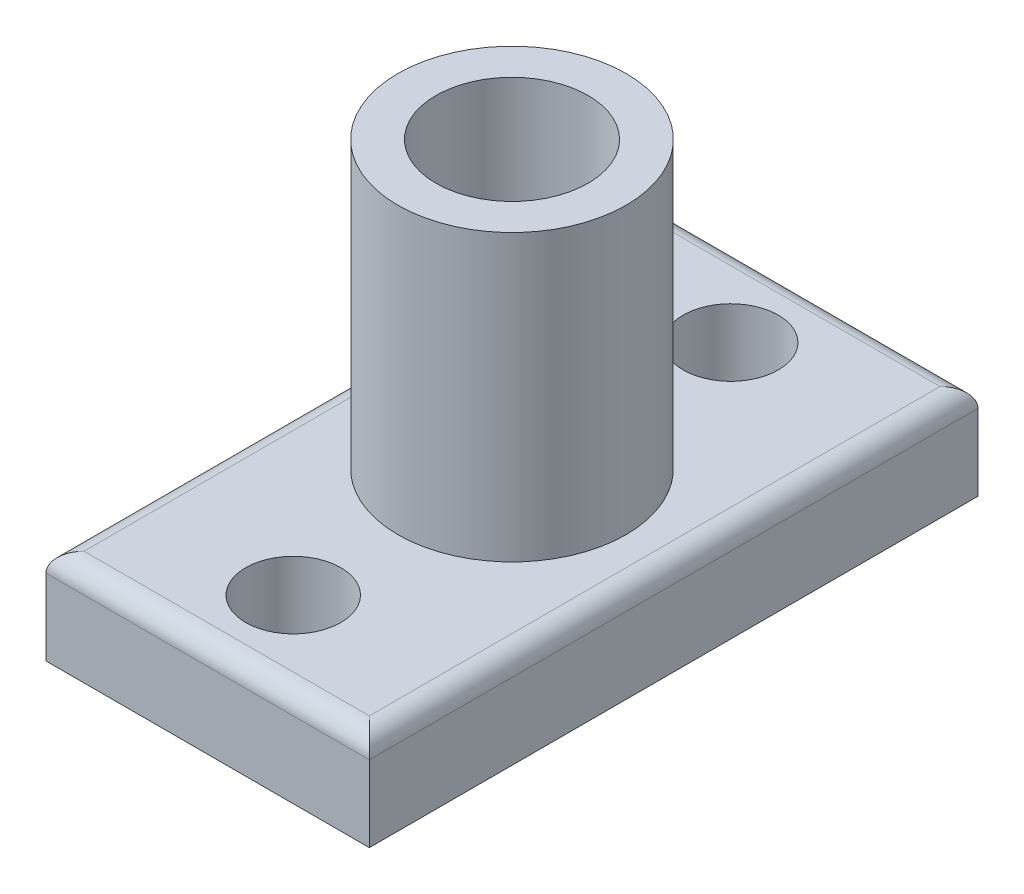
from build123d import *

# Parameters (mm, degrees)
SKETCH1_W           = 17
SKETCH1_H           = 32
SKETCH1_R           = 2.5
BOSS_EXTRUDE1_DEPTH = 5
SKETCH2_R           = 6
SKETCH2_R_2         = 4
BOSS_EXTRUDE2_DEPTH = 15
FILLET1_R           = 1


with BuildPart() as part:
    # Sketch1 → Boss-Extrude1 (new body)
    with BuildSketch(Plane(origin=(0, 0, 0), x_dir=(1, 0, 0), z_dir=(0, 1, 0))):
        Rectangle(SKETCH1_W, SKETCH1_H)
        with Locations((0, 11.5)):
            Circle(SKETCH1_R, mode=Mode.SUBTRACT)
        with Locations((0, -11.5)):
            Circle(SKETCH1_R, mode=Mode.SUBTRACT)
    extrude(amount=BOSS_EXTRUDE1_DEPTH)

    # Sketch2 → Boss-Extrude2 (add)
    with BuildSketch(Plane(origin=(0, 5, 0), x_dir=(1, 0, 0), z_dir=(0, 1, 0))):
        Circle(SKETCH2_R)
        Circle(SKETCH2_R_2, mode=Mode.SUBTRACT)
    extrude(amount=BOSS_EXTRUDE2_DEPTH)

    # Fillet1
    fillet1_edges = [part.edges().sort_by_distance(p)[0] for p in [
        (0, 5, -16),
        (0, 5, 16),
        (-8.5, 5, 0),
        (8.5, 5, 0),
    ]]
    fillet(fillet1_edges, radius=FILLET1_R)


solid = part.part
